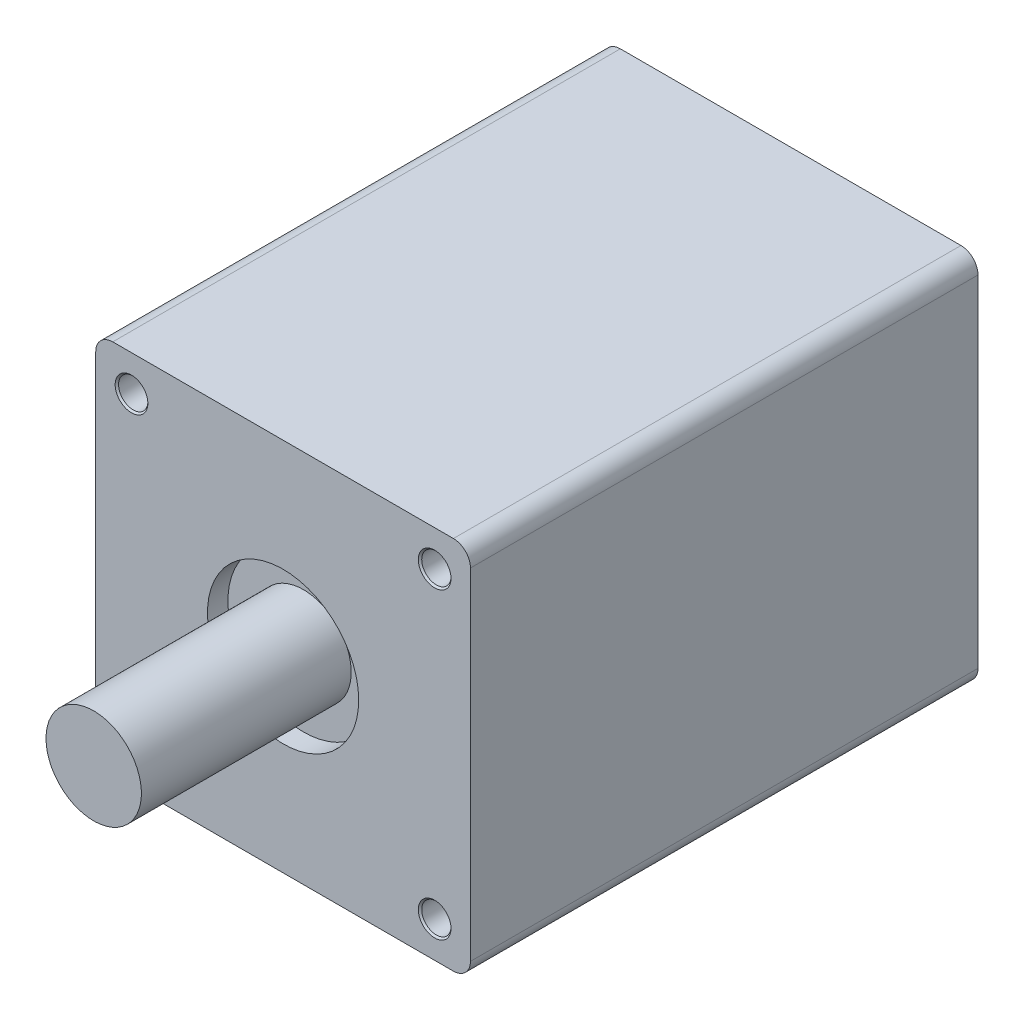
from build123d import *

# Parameters (mm, degrees)
SKETCH1_R             = 4.3
BOSS_EXTRUDE1_DEPTH   = 22
CUT_EXTRUDE1_DEPTH    = 10
CHAMFER1_SIZE         = 0.5
CUT_EXTRUDE2_DEPTH    = 5.6
FILLET1_R             = 1.5
SKETCH6_R             = 27.775
BOSS_EXTRUDE2_DEPTH   = 1.9
SKETCH7_W             = 7.9
SKETCH7_H             = 13.3
SKETCH9_R             = 9.5
BOSS_EXTRUDE3_DEPTH   = 53.7
CHAMFER2_SIZE         = 1
SKETCH11_W            = 6
SKETCH11_H            = 7.2
CUT_EXTRUDE3_DEPTH    = 35
FILLET2_R             = 2.95
BOSS_EXTRUDE4_DEPTH   = 6
SKETCH13_R            = 1.269531582
CUT_EXTRUDE4_DEPTH    = 5
CHAMFER3_SIZE         = 0.5
CHAMFER3_SIZE2        = 1.743707222
CIRPATTERN2_COUNT     = 4
FILLET3_R             = 1.5
SKETCH14_R            = 4.5
BOSS_EXTRUDE5_DEPTH   = 3
FILLET4_R             = 0.5
CUT_EXTRUDE5_DEPTH    = 1.5
CHAMFER4_SIZE         = 1
CHAMFER4_SIZE2        = 2.475086853
CHAMFER4_PART_2_SIZE  = 1
CHAMFER4_PART_2_SIZE2 = 2.475086853
CHAMFER4_PART_3_SIZE  = 1
CHAMFER4_PART_3_SIZE2 = 2.475086853
CHAMFER4_PART_4_SIZE  = 1
CHAMFER4_PART_4_SIZE2 = 2.475086853
CIRPATTERN3_COUNT     = 4
BOSS_EXTRUDE6_DEPTH   = 107
BOSS_EXTRUDE7_DEPTH   = 20
SKETCH18_R            = 17.5
CUT_EXTRUDE6_DEPTH    = 4.6
BOSS_EXTRUDE8_DEPTH   = 2
SKETCH20_R            = 0.781757385
SKETCH20_R_2          = 0.755744111
SKETCH20_R_3          = 0.777591317
BOSS_EXTRUDE9_DEPTH   = 5
BOSS_EXTRUDE10_DEPTH  = 22
BOSS_EXTRUDE11_START  = 137
BOSS_EXTRUDE11_DEPTH  = 137
SKETCH25_W            = 37.737661344
SKETCH25_H            = 66.090824893
CUT_EXTRUDE9_DEPTH    = 53
BOSS_EXTRUDE12_START  = -1.9
SKETCH26_R            = 39.025696269
SKETCH26_R_2          = 23.3
BOSS_EXTRUDE12_DEPTH  = 1.9
SKETCH27_R            = 14
BOSS_EXTRUDE13_DEPTH  = 61.6
BOSS_EXTRUDE14_START  = -7.9
SKETCH28_R            = 23.3
SKETCH28_R_2          = 22.2
BOSS_EXTRUDE14_DEPTH  = 7.9
CUT_EXTRUDE10_START   = -1.9
SKETCH29_R            = 39.025696269
SKETCH29_R_2          = 22.2
CUT_EXTRUDE10_DEPTH   = 1.9
BOSS_EXTRUDE15_START  = -30
SKETCH30_R            = 31.1
SKETCH30_R_2          = 22.2
BOSS_EXTRUDE15_DEPTH  = 30


with BuildPart() as part:
    # Sketch1 → Boss-Extrude1 (new body)
    with BuildSketch(Plane.XY):
        with BuildLine():
            Line((50, -55), (-50, -55))
            ThreePointArc((-50, -55), (-53.535533906, -53.535533906), (-55, -50))
            Line((-55, -50), (-55, 50))
            ThreePointArc((-55, 50), (-53.535533906, 53.535533906), (-50, 55))
            Line((-50, 55), (50, 55))
            ThreePointArc((50, 55), (53.535533906, 53.535533906), (55, 50))
            Line((55, 50), (55, -50))
            ThreePointArc((55, -50), (53.535533906, -53.535533906), (50, -55))
        make_face()
        with Locations((-44.5, 44.5)):
            Circle(SKETCH1_R, mode=Mode.SUBTRACT)
        with Locations((44.5, 44.5)):
            Circle(SKETCH1_R, mode=Mode.SUBTRACT)
        with Locations((-44.5, -44.5)):
            Circle(SKETCH1_R, mode=Mode.SUBTRACT)
        with Locations((44.5, -44.5)):
            Circle(SKETCH1_R, mode=Mode.SUBTRACT)
    extrude(amount=BOSS_EXTRUDE1_DEPTH)

    # Sketch2 → Cut-Extrude1 (cut)
    with BuildSketch(Plane(origin=(0, 0, 0), x_dir=(-1, 0, 0), z_dir=(0, 0, -1))):
        with BuildLine():
            Line((-51, 36.6), (-43.6, 36.6))
            ThreePointArc((-43.6, 36.6), (-38.650252532, 38.650252532), (-36.6, 43.6))
            Line((-36.6, 43.6), (-36.6, 51))
            ThreePointArc((-36.6, 51), (-35.428427125, 53.828427125), (-32.6, 55))
            Line((-32.6, 55), (-50, 55))
            ThreePointArc((-50, 55), (-53.535533906, 53.535533906), (-55, 50))
            Line((-55, 50), (-55, 32.6))
            ThreePointArc((-55, 32.6), (-53.828427125, 35.428427125), (-51, 36.6))
        make_face()
        with BuildLine():
            Line((55, 50), (55, 32.6))
            ThreePointArc((55, 32.6), (53.828427125, 35.428427125), (51, 36.6))
            Line((51, 36.6), (43.6, 36.6))
            ThreePointArc((43.6, 36.6), (38.650252532, 38.650252532), (36.6, 43.6))
            Line((36.6, 43.6), (36.6, 51))
            ThreePointArc((36.6, 51), (35.428427125, 53.828427125), (32.6, 55))
            Line((32.6, 55), (50, 55))
            ThreePointArc((50, 55), (53.535533906, 53.535533906), (55, 50))
        make_face()
        with BuildLine():
            Line((51, -36.6), (43.6, -36.6))
            ThreePointArc((43.6, -36.6), (38.650252532, -38.650252532), (36.6, -43.6))
            Line((36.6, -43.6), (36.6, -51))
            ThreePointArc((36.6, -51), (35.428427125, -53.828427125), (32.6, -55))
            Line((32.6, -55), (50, -55))
            ThreePointArc((50, -55), (53.535533906, -53.535533906), (55, -50))
            Line((55, -50), (55, -32.6))
            ThreePointArc((55, -32.6), (53.828427125, -35.428427125), (51, -36.6))
        make_face()
        with BuildLine():
            Line((-55, -50), (-55, -32.6))
            ThreePointArc((-55, -32.6), (-53.828427125, -35.428427125), (-51, -36.6))
            Line((-51, -36.6), (-43.6, -36.6))
            ThreePointArc((-43.6, -36.6), (-38.650252532, -38.650252532), (-36.6, -43.6))
            Line((-36.6, -43.6), (-36.6, -51))
            ThreePointArc((-36.6, -51), (-35.428427125, -53.828427125), (-32.6, -55))
            Line((-32.6, -55), (-50, -55))
            ThreePointArc((-50, -55), (-53.535533906, -53.535533906), (-55, -50))
        make_face()
    extrude(amount=-CUT_EXTRUDE1_DEPTH, mode=Mode.SUBTRACT)

    # Chamfer1
    chamfer1_edges = [part.edges().sort_by_distance(p)[0] for p in [
        (-48.8, 44.5, 10),
        (-48.8, 44.5, 22),
        (40.2, 44.5, 22),
        (-48.8, -44.5, 22),
        (40.2, -44.5, 22),
        (40.2, -44.5, 10),
        (-48.8, -44.5, 10),
        (40.2, 44.5, 10),
    ]]
    chamfer(chamfer1_edges, length=CHAMFER1_SIZE)

    # Sketch3 → Cut-Extrude2 (cut)
    with BuildSketch(Plane.XY.offset(22)):
        with BuildLine():
            Line((-39, 50), (-39, 60.599803572))
            Line((-39, 60.599803572), (-25, 60.599803572))
            Line((-25, 60.599803572), (-25, 50))
            ThreePointArc((-25, 50), (-32, 43), (-39, 50))
        make_face()
    cut_extrude2 = extrude(amount=-CUT_EXTRUDE2_DEPTH, mode=Mode.SUBTRACT)

    # Fillet1
    fillet1_edges = [part.edges().sort_by_distance(p)[0] for p in [
        (-39, 55, 19.2),
        (-25, 55, 19.2),
    ]]
    fillet(fillet1_edges, radius=FILLET1_R)

    # Sketch6 → Boss-Extrude2 (add)
    with BuildSketch(Plane.XY.offset(22)):
        with Locations(Location((0, 0, 0), (0, 0, 180))):
            Circle(SKETCH6_R)
    extrude(amount=BOSS_EXTRUDE2_DEPTH)

    # Sketch7 → Cut-Revolve1 (revolve, cut)
    with BuildSketch(Plane(origin=(0, 0, 0), x_dir=(0, 0, -1), z_dir=(1, 0, 0)), mode=Mode.PRIVATE) as cut_revolve1_sk:
        Polygon((-22, 27.775), (-21.7, 27.775), (-21.7, 29.9), (-22, 31.1), align=None)
        with Locations((-19.95, 16.65)):
            Rectangle(SKETCH7_W, SKETCH7_H)
    revolve(cut_revolve1_sk.sketch.rotate(Axis((0, 0, 0), (0, 0, 1)), 90), axis=Axis((0, 0, 0), (0, 0, 1)), mode=Mode.SUBTRACT)

    # Sketch9 → Boss-Extrude3 (add)
    with BuildSketch(Plane.XY.offset(23.9)):
        with Locations(Location((0, 0, 0), (0, 0, 180))):
            Circle(SKETCH9_R)
    extrude(amount=BOSS_EXTRUDE3_DEPTH)

    # Chamfer2
    chamfer2_edges = [part.edges().sort_by_distance(p)[0] for p in [
        (9.5, 0, 77.6),
    ]]
    chamfer(chamfer2_edges, length=CHAMFER2_SIZE)

    # Sketch11 → Cut-Extrude3 (cut)
    with BuildSketch(Plane.XY.offset(77.6)):
        with Locations((0, 9.5)):
            Rectangle(SKETCH11_W, SKETCH11_H)
    extrude(amount=-CUT_EXTRUDE3_DEPTH, mode=Mode.SUBTRACT)

    # Fillet2
    fillet2_edges = [part.edges().sort_by_distance(p)[0] for p in [
        (-3, 7.456939094, 42.6),
        (3, 7.456939094, 42.6),
    ]]
    fillet(fillet2_edges, radius=FILLET2_R)

    # Sketch13 → Cut-Extrude4 (cut)
    with BuildSketch(Plane.XY.offset(77.6)):
        Circle(SKETCH13_R)
    extrude(amount=-CUT_EXTRUDE4_DEPTH, mode=Mode.SUBTRACT)

    # Chamfer3
    chamfer3_edges = [part.edges().sort_by_distance(p)[0] for p in [
        (-1.269531582, 0, 77.6),
    ]]
    chamfer3_side = [part.faces().sort_by_distance(p)[0] for p in [
        (-3.23657996, 6.92649343, 77.6),
    ]]
    chamfer(chamfer3_edges, length=CHAMFER3_SIZE, length2=CHAMFER3_SIZE2, reference=chamfer3_side[0])

    # CirPattern2: Cut-Extrude2 ×4 about axis
    cirpattern2_axis = Axis((0, 0, 0), (0, 0, 1))
    for i in range(1, CIRPATTERN2_COUNT):
        add(cut_extrude2.rotate(cirpattern2_axis, i * 360 / CIRPATTERN2_COUNT), mode=Mode.SUBTRACT)

    # Fillet3
    fillet3_edges = [part.edges().sort_by_distance(p)[0] for p in [
        (55, 25, 19.2),
        (55, 39, 19.2),
        (25, -55, 19.2),
        (39, -55, 19.2),
        (-55, -25, 19.2),
        (-55, -39, 19.2),
    ]]
    fillet(fillet3_edges, radius=FILLET3_R)



with BuildPart() as body_2:
    # Sketch12 → Boss-Extrude4 (new body)
    with BuildSketch(Plane(origin=(0, 5.9, 0), x_dir=(1, 0, 0), z_dir=(0, 1, 0))):
        with BuildLine():
            Line((2.95, -45.55), (2.95, -74.55))
            ThreePointArc((2.95, -74.55), (-0.05, -77.55), (-3.05, -74.55))
            Line((-3.05, -74.55), (-3.05, -45.55))
            ThreePointArc((-3.05, -45.55), (-0.05, -42.55), (2.95, -45.55))
        make_face()
    extrude(amount=BOSS_EXTRUDE4_DEPTH)


with BuildPart() as body_3:
    # Sketch14 → Boss-Extrude5 (new body)
    with BuildSketch(Plane.XY.offset(16.4)):
        with Locations((-32, 50)):
            Circle(SKETCH14_R)
    extrude(amount=BOSS_EXTRUDE5_DEPTH)

    # Fillet4
    fillet4_edges = [body_3.edges().sort_by_distance(p)[0] for p in [
        (-36.5, 50, 16.4),
        (-36.5, 50, 19.4),
    ]]
    fillet(fillet4_edges, radius=FILLET4_R)

    # Sketch15 → Cut-Extrude5 (cut)
    with BuildSketch(Plane.XY.offset(19.4)):
        Polygon((-31.205841701, 50.806748085), (-28.673829712, 50.806748085), (-28.673829712, 49.193251915), (-31.205841701, 49.193251915), (-31.205841701, 46.725736586), (-32.794158299, 46.725736586), (-32.794158299, 49.193251915), (-35.326170288, 49.193251915), (-35.326170288, 50.806748085), (-32.794158299, 50.806748085), (-32.794158299, 53.274263414), (-31.205841701, 53.274263414), align=None)
    extrude(amount=-CUT_EXTRUDE5_DEPTH, mode=Mode.SUBTRACT)

    # Chamfer4
    chamfer4_edges = [body_3.edges().sort_by_distance(p)[0] for p in [
        (-32, 46.725736586, 17.9),
    ]]
    chamfer4_side = [body_3.faces().sort_by_distance(p)[0] for p in [
        (-32, 46.725736586, 18.65),
    ]]
    chamfer(chamfer4_edges, length=CHAMFER4_SIZE, length2=CHAMFER4_SIZE2, reference=chamfer4_side[0])

    # Chamfer4 part 2
    chamfer4_part_2_edges = [body_3.edges().sort_by_distance(p)[0] for p in [
        (-32, 53.274263414, 17.9),
    ]]
    chamfer4_part_2_side = [body_3.faces().sort_by_distance(p)[0] for p in [
        (-32, 53.274263414, 18.65),
    ]]
    chamfer(chamfer4_part_2_edges, length=CHAMFER4_PART_2_SIZE, length2=CHAMFER4_PART_2_SIZE2, reference=chamfer4_part_2_side[0])

    # Chamfer4 part 3
    chamfer4_part_3_edges = [body_3.edges().sort_by_distance(p)[0] for p in [
        (-35.326170288, 50, 17.9),
    ]]
    chamfer4_part_3_side = [body_3.faces().sort_by_distance(p)[0] for p in [
        (-35.326170288, 50, 18.65),
    ]]
    chamfer(chamfer4_part_3_edges, length=CHAMFER4_PART_3_SIZE, length2=CHAMFER4_PART_3_SIZE2, reference=chamfer4_part_3_side[0])

    # Chamfer4 part 4
    chamfer4_part_4_edges = [body_3.edges().sort_by_distance(p)[0] for p in [
        (-28.673829712, 50, 17.9),
    ]]
    chamfer4_part_4_side = [body_3.faces().sort_by_distance(p)[0] for p in [
        (-28.673829712, 50, 18.65),
    ]]
    chamfer(chamfer4_part_4_edges, length=CHAMFER4_PART_4_SIZE, length2=CHAMFER4_PART_4_SIZE2, reference=chamfer4_part_4_side[0])


with BuildPart() as cirpattern3_1:
    # CirPattern3: pattern copy
    add(body_3.part.rotate(Axis((0, 0, 0), (0, 0, 1)), 1 * 360 / CIRPATTERN3_COUNT))


with BuildPart() as cirpattern3_2:
    # CirPattern3: pattern copy
    add(body_3.part.rotate(Axis((0, 0, 0), (0, 0, 1)), 2 * 360 / CIRPATTERN3_COUNT))


with BuildPart() as cirpattern3_3:
    # CirPattern3: pattern copy
    add(body_3.part.rotate(Axis((0, 0, 0), (0, 0, 1)), 3 * 360 / CIRPATTERN3_COUNT))


with BuildPart() as body_7:
    # Sketch16 → Boss-Extrude6 (new body)
    with BuildSketch(Plane(origin=(0, 0, 0), x_dir=(-1, 0, 0), z_dir=(0, 0, -1))):
        with BuildLine():
            Line((55, -32.6), (55, 32.6))
            ThreePointArc((55, 32.6), (53.828427125, 35.428427125), (51, 36.6))
            Line((51, 36.6), (43.6, 36.6))
            ThreePointArc((43.6, 36.6), (38.650252532, 38.650252532), (36.6, 43.6))
            Line((36.6, 43.6), (36.6, 51))
            ThreePointArc((36.6, 51), (35.428427125, 53.828427125), (32.6, 55))
            Line((32.6, 55), (-32.6, 55))
            ThreePointArc((-32.6, 55), (-35.428427125, 53.828427125), (-36.6, 51))
            Line((-36.6, 51), (-36.6, 43.6))
            ThreePointArc((-36.6, 43.6), (-38.650252532, 38.650252532), (-43.6, 36.6))
            Line((-43.6, 36.6), (-51, 36.6))
            ThreePointArc((-51, 36.6), (-53.828427125, 35.428427125), (-55, 32.6))
            Line((-55, 32.6), (-55, -32.6))
            ThreePointArc((-55, -32.6), (-53.828427125, -35.428427125), (-51, -36.6))
            Line((-51, -36.6), (-43.6, -36.6))
            ThreePointArc((-43.6, -36.6), (-38.650252532, -38.650252532), (-36.6, -43.6))
            Line((-36.6, -43.6), (-36.6, -51))
            ThreePointArc((-36.6, -51), (-35.428427125, -53.828427125), (-32.6, -55))
            Line((-32.6, -55), (32.6, -55))
            ThreePointArc((32.6, -55), (35.428427125, -53.828427125), (36.6, -51))
            Line((36.6, -51), (36.6, -43.6))
            ThreePointArc((36.6, -43.6), (38.650252532, -38.650252532), (43.6, -36.6))
            Line((43.6, -36.6), (51, -36.6))
            ThreePointArc((51, -36.6), (53.828427125, -35.428427125), (55, -32.6))
        make_face()
    extrude(amount=BOSS_EXTRUDE6_DEPTH)


with BuildPart() as body_8:
    # Sketch17 → Boss-Extrude7 (new body)
    with BuildSketch(Plane(origin=(0, 0, -107), x_dir=(-1, 0, 0), z_dir=(0, 0, -1))):
        with BuildLine():
            Line((55, -32.6), (55, 32.6))
            ThreePointArc((55, 32.6), (53.828427125, 35.428427125), (51, 36.6))
            Line((51, 36.6), (43.6, 36.6))
            ThreePointArc((43.6, 36.6), (38.650252532, 38.650252532), (36.6, 43.6))
            Line((36.6, 43.6), (36.6, 51))
            ThreePointArc((36.6, 51), (35.428427125, 53.828427125), (32.6, 55))
            Line((32.6, 55), (-32.6, 55))
            ThreePointArc((-32.6, 55), (-35.428427125, 53.828427125), (-36.6, 51))
            Line((-36.6, 51), (-36.6, 43.6))
            ThreePointArc((-36.6, 43.6), (-38.650252532, 38.650252532), (-43.6, 36.6))
            Line((-43.6, 36.6), (-51, 36.6))
            ThreePointArc((-51, 36.6), (-53.828427125, 35.428427125), (-55, 32.6))
            Line((-55, 32.6), (-55, -32.6))
            ThreePointArc((-55, -32.6), (-53.828427125, -35.428427125), (-51, -36.6))
            Line((-51, -36.6), (-43.6, -36.6))
            ThreePointArc((-43.6, -36.6), (-38.650252532, -38.650252532), (-36.6, -43.6))
            Line((-36.6, -43.6), (-36.6, -51))
            ThreePointArc((-36.6, -51), (-35.428427125, -53.828427125), (-32.6, -55))
            Line((-32.6, -55), (32.6, -55))
            ThreePointArc((32.6, -55), (35.428427125, -53.828427125), (36.6, -51))
            Line((36.6, -51), (36.6, -43.6))
            ThreePointArc((36.6, -43.6), (38.650252532, -38.650252532), (43.6, -36.6))
            Line((43.6, -36.6), (51, -36.6))
            ThreePointArc((51, -36.6), (53.828427125, -35.428427125), (55, -32.6))
        make_face()
    extrude(amount=BOSS_EXTRUDE7_DEPTH)

    # Sketch18 → Cut-Extrude6 (cut)
    with BuildSketch(Plane(origin=(0, 0, -127), x_dir=(-1, 0, 0), z_dir=(0, 0, -1))):
        Circle(SKETCH18_R)
    extrude(amount=-CUT_EXTRUDE6_DEPTH, mode=Mode.SUBTRACT)


with BuildPart() as body_9:
    # Sketch19 → Boss-Extrude8 (new body)
    with BuildSketch(Plane(origin=(0, 55, 0), x_dir=(1, 0, 0), z_dir=(0, 1, 0))):
        with BuildLine():
            Line((-7, 119.5319481), (-7, 106.5319481))
            Line((-7, 106.5319481), (7, 106.5319481))
            Line((7, 106.5319481), (7, 119.5319481))
            ThreePointArc((7, 119.5319481), (0, 126.5319481), (-7, 119.5319481))
        make_face()
    extrude(amount=BOSS_EXTRUDE8_DEPTH)

    # Sketch20 → Boss-Extrude9 (add)
    with BuildSketch(Plane(origin=(0, 57, 0), x_dir=(1, 0, 0), z_dir=(0, 1, 0))):
        with Locations(Location((-1.527965291, 111.959324304, 0), (0, 0, 270))):
            Circle(SKETCH20_R)
        with Locations(Location((0, 111.177566919, 0), (0, 0, 270))):
            Circle(SKETCH20_R)
        with Locations(Location((1.06638621, 112.393181791, 0), (0, 0, 270))):
            Circle(SKETCH20_R_2)
        with Locations(Location((0.985840453, 109.917406178, 0), (0, 0, 270))):
            Circle(SKETCH20_R_3)
    extrude(amount=BOSS_EXTRUDE9_DEPTH)


with BuildPart() as part_1:
    add(part.part)

    add(body_3.part)  # Boss-Extrude10 merges body 3

    add(cirpattern3_1.part)  # Boss-Extrude10 merges CirPattern3_1

    add(cirpattern3_2.part)  # Boss-Extrude10 merges CirPattern3_2

    add(cirpattern3_3.part)  # Boss-Extrude10 merges CirPattern3_3

    add(body_7.part)  # Boss-Extrude10 merges body 7
    # Sketch22 → Boss-Extrude10 (add)
    with BuildSketch(Plane.XY.offset(22)):
        Polygon((-15.060402007, 38.994521077), (-31.516759856, 38.994521077), (-45.25, 52.727761221), (-45.25, 55), (-15.060402007, 55), align=None)
        Polygon((36.525802568, -39.365731509), (15.868239662, -39.365731509), (15.868239662, -55), (42.988503812, -55), align=None)
        Polygon((-55, -20.208438535), (-35.602559533, -20.208438535), (-35.602559533, -34.634110956), (-55, -43.058703649), align=None)
        Polygon((36.525802568, 33.10884673), (55, 45.25), (55, 16.83668824), align=None)
    extrude(amount=-BOSS_EXTRUDE10_DEPTH)


    add(body_8.part)  # Boss-Extrude11 merges body 8

    add(body_9.part)  # Boss-Extrude11 merges body 9
    # Sketch23 → Boss-Extrude11 (add)
    with BuildSketch(Plane(origin=(0, 0, 10), x_dir=(-1, 0, 0), z_dir=(0, 0, -1)).offset(BOSS_EXTRUDE11_START)):
        with BuildLine():
            Line((-50, 55), (50, 55))
            ThreePointArc((50, 55), (53.535533906, 53.535533906), (55, 50))
            Line((55, 50), (55, -50))
            ThreePointArc((55, -50), (53.535533906, -53.535533906), (50, -55))
            Line((50, -55), (-50, -55))
            ThreePointArc((-50, -55), (-53.535533906, -53.535533906), (-55, -50))
            Line((-55, -50), (-55, 50))
            ThreePointArc((-55, 50), (-53.535533906, 53.535533906), (-50, 55))
        make_face()
    extrude(amount=-BOSS_EXTRUDE11_DEPTH)

    # Sketch25 → Cut-Extrude9 (cut)
    with BuildSketch(Plane(origin=(0, 55, 0), x_dir=(1, 0, 0), z_dir=(0, 1, 0))):
        with Locations((1.397691161, 98.078785947)):
            Rectangle(SKETCH25_W, SKETCH25_H)
    extrude(amount=CUT_EXTRUDE9_DEPTH, mode=Mode.SUBTRACT)

    # Sketch26 → Boss-Extrude12 (add)
    with BuildSketch(Plane.XY.offset(23.9).offset(BOSS_EXTRUDE12_START)):
        Circle(SKETCH26_R)
        with Locations(Location((0, 0, 0), (0, 0, 180))):
            Circle(SKETCH26_R_2, mode=Mode.SUBTRACT)
    extrude(amount=BOSS_EXTRUDE12_DEPTH)


    add(body_2.part)  # Boss-Extrude13 merges body 2
    # Sketch27 → Boss-Extrude13 (add)
    with BuildSketch(Plane.XY.offset(16)):
        with Locations(Location((0, 0, 0), (0, 0, 180))):
            Circle(SKETCH27_R)
    extrude(amount=BOSS_EXTRUDE13_DEPTH)

    # Sketch28 → Boss-Extrude14 (add)
    with BuildSketch(Plane.XY.offset(23.9).offset(BOSS_EXTRUDE14_START)):
        Circle(SKETCH28_R)
        Circle(SKETCH28_R_2, mode=Mode.SUBTRACT)
    extrude(amount=BOSS_EXTRUDE14_DEPTH)

    # Sketch29 → Cut-Extrude10 (cut)
    with BuildSketch(Plane.XY.offset(23.9).offset(CUT_EXTRUDE10_START)):
        Circle(SKETCH29_R)
        Circle(SKETCH29_R_2, mode=Mode.SUBTRACT)
    extrude(amount=CUT_EXTRUDE10_DEPTH, mode=Mode.SUBTRACT)

    # Sketch30 → Boss-Extrude15 (add)
    with BuildSketch(Plane.XY.offset(22).offset(BOSS_EXTRUDE15_START)):
        Circle(SKETCH30_R)
        Circle(SKETCH30_R_2, mode=Mode.SUBTRACT)
    extrude(amount=BOSS_EXTRUDE15_DEPTH)


solid = part_1.part
